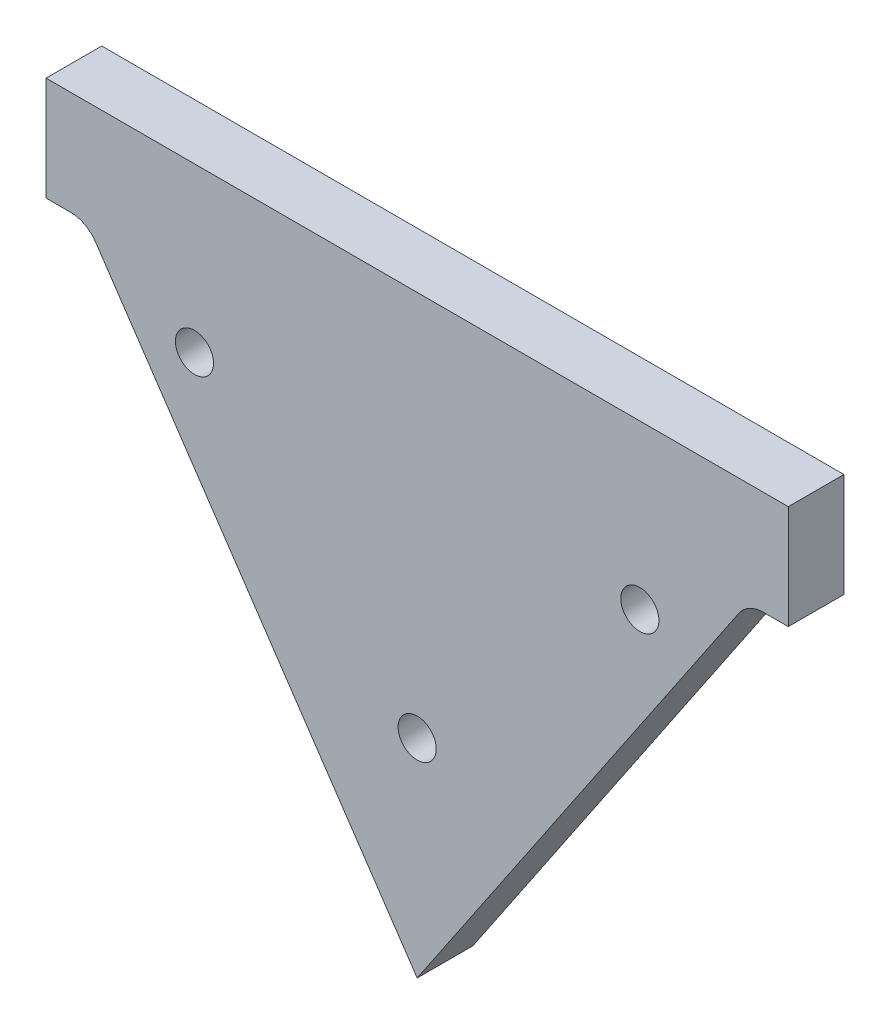
from build123d import *

# Parameters (mm, degrees)
BOSS_EXTRUDE1_DEPTH      = 9.525
F_0_257_DIAMETER_HOLE1_D = 6.5278


with BuildPart() as part:
    # Sketch2 → Boss-Extrude1 (new body)
    with BuildSketch(Plane.XY):
        with BuildLine():
            Line((55.052713332, 22.021494375), (0, -59.560100659))
            Line((0, -59.560100659), (-55.052713332, 22.021494375))
            ThreePointArc((-55.052713332, 22.021494375), (-56.879181473, 23.665526542), (-59.26362032, 24.259899341))
            Line((-59.26362032, 24.259899341), (-63.5, 24.259899341))
            Line((-63.5, 24.259899341), (-63.5, 42.039899341))
            Line((-63.5, 42.039899341), (63.5, 42.039899341))
            Line((63.5, 42.039899341), (63.5, 24.259899341))
            Line((63.5, 24.259899341), (59.26362032, 24.259899341))
            ThreePointArc((59.26362032, 24.259899341), (56.879181473, 23.665526542), (55.052713332, 22.021494375))
        make_face()
    extrude(amount=BOSS_EXTRUDE1_DEPTH)

    # F (0.257) Diameter Hole1 (through all)
    with Locations(Plane.XY.offset(9.525)):
        with Locations((0, -24.000100659), (-38.1, 14.099899341), (38.1, 14.099899341)):
            Hole(F_0_257_DIAMETER_HOLE1_D / 2)


solid = part.part
